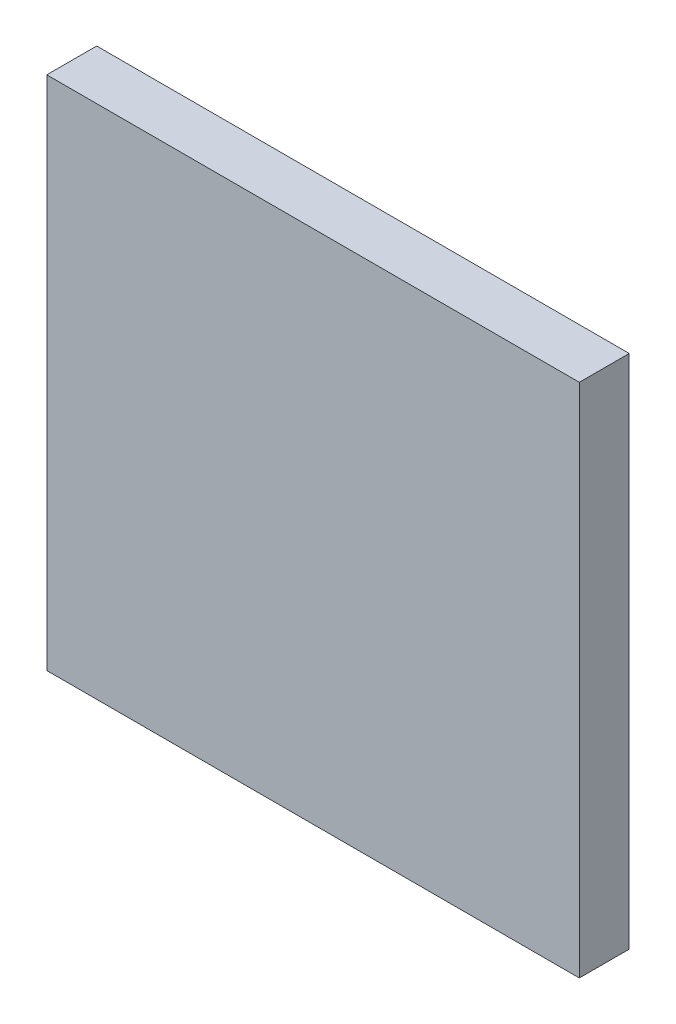
from build123d import *

# Parameters (mm, degrees)
IZIM1_W            = 320
IZIM1_H            = 310
TABAN_FLAN_1_DEPTH = 30


# Sheet-metal steps are written as plain solids
with BuildPart() as part:
    # Çizim1 → Taban-Flanş1 (new body)
    with BuildSketch(Plane.XY):
        with Locations((160, -155)):
            Rectangle(IZIM1_W, IZIM1_H)
    extrude(amount=-TABAN_FLAN_1_DEPTH)


solid = part.part
